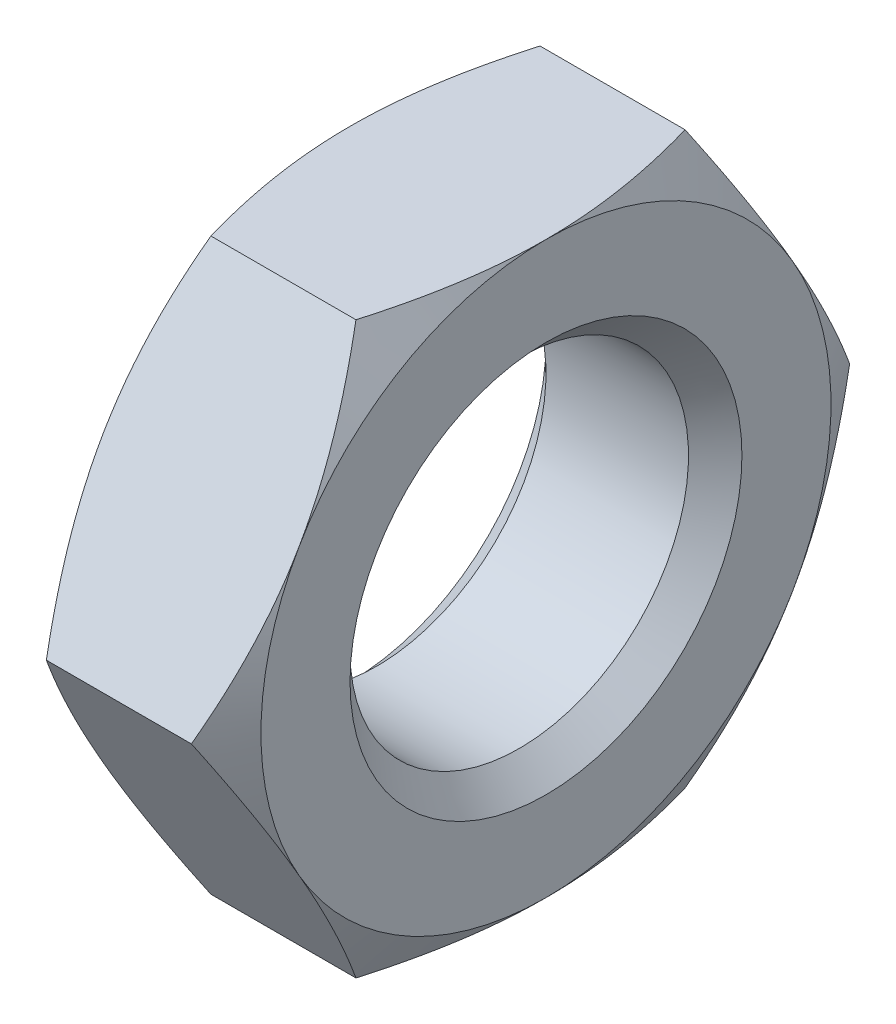
from build123d import *

# Parameters (mm, degrees)
SKETCH1_R      = 9.5
EXTRUDE1_DEPTH = 5.5
SMUSSO1_SIZE   = 1.5


# Read off the part's stored shape, not the designer's step: Cut-Extrude1
with BuildPart() as part:
    # Sketch1 → Extrude1 (new, symmetric)
    with BuildSketch(Plane(origin=(0, 0, 0), x_dir=(0, 0, -1), z_dir=(1, 0, 0))):
        Polygon((18.475208614, 0), (9.237604307, 16), (-9.237604307, 16), (-18.475208614, 0), (-9.237604307, -16), (9.237604307, -16), align=None)
        Circle(SKETCH1_R, mode=Mode.SUBTRACT)
    extrude(amount=EXTRUDE1_DEPTH, both=True)

    # Cut-Extrude1 outline → Cut-Extrude1 (revolve, cut)
    with BuildSketch(Plane.YX):
        Polygon((18.475208616, 5.500000004), (15.999999996, 5.500000004), (18.475208616, 4.070937639), align=None)
    cut_extrude1 = revolve(axis=Axis((0, 0, 0), (1, 0, 0)), mode=Mode.SUBTRACT)

    # Mirror1: Cut-Extrude1 across plane
    add(cut_extrude1.mirror(Plane(origin=(0, 0, 0), x_dir=(0, 0, 1), z_dir=(1, 0, 0))), mode=Mode.SUBTRACT)

    # Smusso1
    smusso1_edges = [part.edges().sort_by_distance(p)[0] for p in [
        (-5.5, 0, 9.5),
        (5.5, 0, 9.5),
    ]]
    chamfer(smusso1_edges, length=SMUSSO1_SIZE)


solid = part.part
